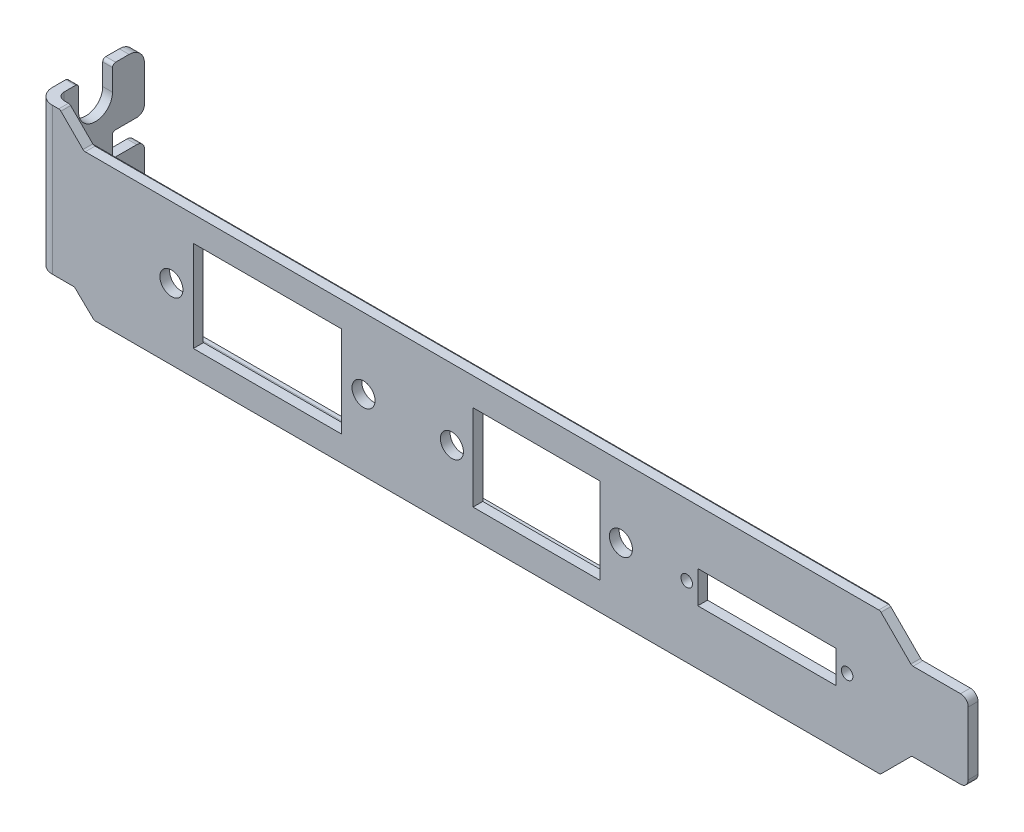
from build123d import *

# Parameters (mm, degrees)
BOSS_EXTRUDE1_DEPTH     = 1.27
SKETCH8_W               = 1.27
SKETCH8_H               = 19.05
BOSS_EXTRUDE3_DEPTH     = 11.454
CUT_EXTRUDE6_REACH      = 125.629
SKETCH9_W               = 4.19
SKETCH9_H               = 3.05
SKETCH10_W              = 100
SKETCH10_H              = 1.5
SKETCH10_W_2            = 105
BOSS_EXTRUDE4_DEPTH     = 1
SKETCH3_R               = 1.5
SKETCH3_W               = 19.3
SKETCH3_H               = 11.85
XT60_CUTOUT_DEPTH       = 124.753307334
CUT_EXTRUDE4_DEPTH      = 124.753307334
CUT_EXTRUDE4_DEPTH_BACK = 124.753307334
SKETCH5_R               = 1.5
SKETCH5_W               = 16.5
SKETCH5_H               = 11.2
SKETCH6_R               = 0.75
SKETCH6_W               = 18
SKETCH6_H               = 4.2
CUT_EXTRUDE5_DEPTH      = 124.753307334
FILLET1_R               = 0.4
FILLET2_R               = 1
FILLET3_R               = 2
FILLET4_R               = 0.5


with BuildPart() as part:
    # Sketch1 → Boss-Extrude1 (new body)
    with BuildSketch(Plane.XY):
        Polygon((0, 2.48), (4.88, 2.48), (7.45, 0), (109.76, 0), (113.85, 4.09), (121.2, 4.09), (121.2, 14.3), (113.85, 14.3), (109.73, 18.42), (6.11, 18.42), (3, 21.53), (0, 21.53), align=None)
    extrude(amount=BOSS_EXTRUDE1_DEPTH)

    # Sketch8 → Boss-Extrude3 (add)
    with BuildSketch(Plane(origin=(0, 0, 0), x_dir=(-1, 0, 0), z_dir=(0, 0, -1))):
        with Locations((-0.635, 12.005)):
            Rectangle(SKETCH8_W, SKETCH8_H)
    extrude(amount=BOSS_EXTRUDE3_DEPTH)

    # Sketch9 → Cut-Extrude6 (cut, up to next)
    with BuildSketch(Plane.ZY, mode=Mode.PRIVATE) as cut_extrude6_sk1:
        with BuildLine():
            Line((-7.29, 18.35), (-7.29, 21.53))
            Line((-7.29, 21.53), (-2.87, 21.53))
            Line((-2.87, 21.53), (-2.87, 18.35))
            ThreePointArc((-2.87, 18.35), (-5.08, 16.14), (-7.29, 18.35))
        make_face()
    cut_extrude6_tool1 = extrude(cut_extrude6_sk1.sketch, amount=-CUT_EXTRUDE6_REACH, mode=Mode.PRIVATE) & part.part
    # Sketch9 → Cut-Extrude6 (cut, up to next)
    with BuildSketch(Plane.ZY, mode=Mode.PRIVATE) as cut_extrude6_sk2:
        with Locations((-9.359, 12.385)):
            Rectangle(SKETCH9_W, SKETCH9_H)
    cut_extrude6_tool2 = extrude(cut_extrude6_sk2.sketch, amount=-CUT_EXTRUDE6_REACH, mode=Mode.PRIVATE) & part.part
    add(cut_extrude6_tool1.solids().sort_by_distance((0, 19.047387, -5.08))[0], mode=Mode.SUBTRACT)
    add(cut_extrude6_tool2.solids().sort_by_distance((0, 12.385, -9.359))[0], mode=Mode.SUBTRACT)

    # Sketch10 → Boss-Extrude4 (add)
    with BuildSketch(Plane(origin=(0, 0, 0), x_dir=(-1, 0, 0), z_dir=(0, 0, -1))):
        with Locations((-57, 2.25)):
            Rectangle(SKETCH10_W, SKETCH10_H)
        with Locations((-56.5, 16.75)):
            Rectangle(SKETCH10_W_2, SKETCH10_H)
    extrude(amount=BOSS_EXTRUDE4_DEPTH)

    # Sketch3 → XT60 cutout (cut, through all)
    with BuildSketch(Plane.XY.offset(1.27)):
        with Locations((17.5, 9.21)):
            Circle(SKETCH3_R)
        with Locations((42.5, 9.21)):
            Circle(SKETCH3_R)
        with Locations((30, 9.21)):
            Rectangle(SKETCH3_W, SKETCH3_H)
    extrude(amount=-XT60_CUTOUT_DEPTH, mode=Mode.SUBTRACT)

    # Sketch5 → Cut-Extrude4 (cut, two sides: drawn at the far end of the back side and taken through both)
    with BuildSketch(Plane.XY.offset(1.27).offset(-CUT_EXTRUDE4_DEPTH_BACK)):
        with Locations((54, 9.21)):
            Circle(SKETCH5_R)
        with Locations((76, 9.21)):
            Circle(SKETCH5_R)
        with Locations((65, 9.21)):
            Rectangle(SKETCH5_W, SKETCH5_H)
    extrude(amount=CUT_EXTRUDE4_DEPTH + CUT_EXTRUDE4_DEPTH_BACK, mode=Mode.SUBTRACT)

    # Sketch6 → Cut-Extrude5 (cut, through all)
    with BuildSketch(Plane.XY.offset(1.27)):
        with Locations((105.44, 9.21)):
            Circle(SKETCH6_R)
        with Locations((84.56, 9.21)):
            Circle(SKETCH6_R)
        with Locations((95, 9.21)):
            Rectangle(SKETCH6_W, SKETCH6_H)
    extrude(amount=-CUT_EXTRUDE5_DEPTH, mode=Mode.SUBTRACT)

    # Fillet1
    fillet1_edges = [part.edges().sort_by_distance(p)[0] for p in [
        (109.76, 0, 0.635),
        (7.45, 0, 0.635),
        (4.88, 2.48, 0.635),
        (3, 21.53, 0.635),
        (6.11, 18.42, 0.635),
        (109.73, 18.42, 0.635),
        (113.85, 14.3, 0.635),
        (113.85, 4.09, 0.635),
        (0.635, 13.91, -7.264),
        (0.635, 10.86, -7.264),
        (0.635, 21.53, -7.29),
        (0.635, 21.53, -2.87),
    ]]
    fillet(fillet1_edges, radius=FILLET1_R)

    # Fillet2
    fillet2_edges = [part.edges().sort_by_distance(p)[0] for p in [
        (121.2, 14.3, 0.635),
        (121.2, 4.09, 0.635),
        (1.27, 12.005, 0),
        (0.635, 10.86, -11.454),
        (0.635, 13.91, -11.454),
    ]]
    fillet(fillet2_edges, radius=FILLET2_R)

    # Fillet3
    fillet3_edges = [part.edges().sort_by_distance(p)[0] for p in [
        (0, 12.005, 1.27),
        (0.635, 21.53, -11.454),
        (0.635, 2.48, -11.454),
    ]]
    fillet(fillet3_edges, radius=FILLET3_R)

    # Fillet4
    # the kernel refuses this fillet: 0.5 mm, written as the material it takes off along each edge
    with BuildSketch(Plane(origin=(109, 17.5, 0), x_dir=(0, -1, 0), z_dir=(0, 0, -1)), Plane(origin=(107, 3, 0), x_dir=(0, -1, 0), z_dir=(0, 0, -1)), Plane(origin=(107, 1.5, 0), x_dir=(-1, 0, 0), z_dir=(0, 0, -1)), Plane(origin=(4, 17.5, 0), x_dir=(1, 0, 0), z_dir=(0, 0, -1))) as fillet4_piece_1:
        with BuildLine():
            CenterArc((FILLET4_R, FILLET4_R), FILLET4_R, 180, 90)
            Line((0, FILLET4_R), (0, 0))
            Line((0, 0), (FILLET4_R, 0))
        make_face()
    extrude(amount=2.25, mode=Mode.SUBTRACT)
    with BuildSketch(Plane(origin=(109, 18.75, -1), x_dir=(0, 0, 1), z_dir=(0, -1, 0)), Plane(origin=(4, 14.75, -1), x_dir=(0, 0, 1), z_dir=(0, 1, 0))) as fillet4_piece_2:
        with BuildLine():
            CenterArc((FILLET4_R, FILLET4_R), FILLET4_R, 180, 90)
            Line((0, FILLET4_R), (0, 0))
            Line((0, 0), (FILLET4_R, 0))
        make_face()
    extrude(amount=4, mode=Mode.SUBTRACT)
    with BuildSketch(Plane(origin=(109, 16, 0), x_dir=(0, 1, 0), z_dir=(0, 0, -1)), Plane(origin=(4, 16, 0), x_dir=(1, 0, 0), z_dir=(0, 0, -1)), Plane(origin=(7, 1.5, 0), x_dir=(1, 0, 0), z_dir=(0, 0, -1)), Plane(origin=(7, 3, 0), x_dir=(0, -1, 0), z_dir=(0, 0, -1))) as fillet4_piece_3:
        with BuildLine():
            CenterArc((FILLET4_R, -FILLET4_R), FILLET4_R, 90, 90)
            Line((0, -FILLET4_R), (0, 0))
            Line((0, 0), (FILLET4_R, 0))
        make_face()
    extrude(amount=2.25, mode=Mode.SUBTRACT)
    with BuildSketch(Plane(origin=(107, 0.25, -1), x_dir=(0, 0, 1), z_dir=(0, 1, 0)), Plane(origin=(7, 4.25, -1), x_dir=(0, 0, 1), z_dir=(0, -1, 0))) as fillet4_piece_4:
        with BuildLine():
            CenterArc((FILLET4_R, -FILLET4_R), FILLET4_R, 90, 90)
            Line((0, -FILLET4_R), (0, 0))
            Line((0, 0), (FILLET4_R, 0))
        make_face()
    extrude(amount=4, mode=Mode.SUBTRACT)
    # the kernel refuses this fillet: 0.5 mm, written as the material it adds along each edge
    with BuildSketch(Plane(origin=(108.5, 16, 0), x_dir=(0, -1, 0), z_dir=(-1, 0, 0)), Plane(origin=(4.5, 17.5, 0), x_dir=(0, 1, 0), z_dir=(1, 0, 0))) as fillet4_2_piece_1:
        with BuildLine():
            CenterArc((FILLET4_R, -FILLET4_R), FILLET4_R, 90, 90)
            Line((0, -FILLET4_R), (0, 0))
            Line((0, 0), (FILLET4_R, 0))
        make_face()
    extrude(amount=104)
    with BuildSketch(Plane(origin=(7.5, 1.5, 0), x_dir=(0, -1, 0), z_dir=(1, 0, 0))) as fillet4_2_piece_2:
        with BuildLine():
            CenterArc((FILLET4_R, FILLET4_R), FILLET4_R, 180, 90)
            Line((0, FILLET4_R), (0, 0))
            Line((0, 0), (FILLET4_R, 0))
        make_face()
    extrude(amount=99)
    with BuildSketch(Plane(origin=(106.5, 3, 0), x_dir=(0, 1, 0), z_dir=(-1, 0, 0))) as fillet4_2_piece_3_section:
        with BuildLine():
            CenterArc((FILLET4_R, FILLET4_R), FILLET4_R, 180, 90)
            Line((0, FILLET4_R), (0, 0))
            Line((0, 0), (FILLET4_R, 0))
        make_face()
    fillet4_2_piece_3 = extrude(amount=99, mode=Mode.PRIVATE)
    fillet4_2_piece_3 = split(fillet4_2_piece_3, bisect_by=Plane(origin=(73.075, 3.285, -0.00692804), z_dir=(0, 1, 0)), keep=Keep.TOP, mode=Mode.PRIVATE)
    fillet4_2_piece_3 = split(fillet4_2_piece_3, bisect_by=Plane(origin=(39.65, 3.359200662, -0.00692804), z_dir=(1, 0, 0)), keep=Keep.TOP, mode=Mode.PRIVATE)
    add(fillet4_2_piece_3)
    with BuildSketch(Plane(origin=(106.5, 3, 0), x_dir=(0, 1, 0), z_dir=(-1, 0, 0))) as fillet4_2_piece_4_section:
        with BuildLine():
            CenterArc((FILLET4_R, FILLET4_R), FILLET4_R, 180, 90)
            Line((0, FILLET4_R), (0, 0))
            Line((0, 0), (FILLET4_R, 0))
        make_face()
    fillet4_2_piece_4 = extrude(amount=99, mode=Mode.PRIVATE)
    fillet4_2_piece_4 = split(fillet4_2_piece_4, bisect_by=Plane(origin=(73.075, 3.285, -0.123354131), z_dir=(0, -1, 0)), keep=Keep.TOP, mode=Mode.PRIVATE)
    fillet4_2_piece_4 = split(fillet4_2_piece_4, bisect_by=Plane(origin=(39.65, 3.089686123, -0.123354131), z_dir=(1, 0, 0)), keep=Keep.TOP, mode=Mode.PRIVATE)
    add(fillet4_2_piece_4)
    with BuildSketch(Plane(origin=(106.5, 3, 0), x_dir=(0, 1, 0), z_dir=(-1, 0, 0))) as fillet4_2_piece_5_section:
        with BuildLine():
            CenterArc((FILLET4_R, FILLET4_R), FILLET4_R, 180, 90)
            Line((0, FILLET4_R), (0, 0))
            Line((0, 0), (FILLET4_R, 0))
        make_face()
    fillet4_2_piece_5 = extrude(amount=99, mode=Mode.PRIVATE)
    fillet4_2_piece_5 = split(fillet4_2_piece_5, bisect_by=Plane(origin=(30, 3.285, -0.123354131), z_dir=(0, -1, 0)), keep=Keep.TOP, mode=Mode.PRIVATE)
    fillet4_2_piece_5 = split(fillet4_2_piece_5, bisect_by=Plane(origin=(20.35, 3.089686123, -0.123354131), z_dir=(1, 0, 0)), keep=Keep.TOP, mode=Mode.PRIVATE)
    fillet4_2_piece_5 = split(fillet4_2_piece_5, bisect_by=Plane(origin=(39.65, 3.089686123, -0.123354131), z_dir=(-1, 0, 0)), keep=Keep.TOP, mode=Mode.PRIVATE)
    add(fillet4_2_piece_5)
    with BuildSketch(Plane(origin=(106.5, 3, 0), x_dir=(0, 1, 0), z_dir=(-1, 0, 0))) as fillet4_2_piece_6_section:
        with BuildLine():
            CenterArc((FILLET4_R, FILLET4_R), FILLET4_R, 180, 90)
            Line((0, FILLET4_R), (0, 0))
            Line((0, 0), (FILLET4_R, 0))
        make_face()
    fillet4_2_piece_6 = extrude(amount=99, mode=Mode.PRIVATE)
    fillet4_2_piece_6 = split(fillet4_2_piece_6, bisect_by=Plane(origin=(13.925, 3.285, -0.00692804), z_dir=(0, 1, 0)), keep=Keep.TOP, mode=Mode.PRIVATE)
    fillet4_2_piece_6 = split(fillet4_2_piece_6, bisect_by=Plane(origin=(20.35, 3.359200662, -0.00692804), z_dir=(-1, 0, 0)), keep=Keep.TOP, mode=Mode.PRIVATE)
    add(fillet4_2_piece_6)
    with BuildSketch(Plane(origin=(106.5, 3, 0), x_dir=(0, 1, 0), z_dir=(-1, 0, 0))) as fillet4_2_piece_7_section:
        with BuildLine():
            CenterArc((FILLET4_R, FILLET4_R), FILLET4_R, 180, 90)
            Line((0, FILLET4_R), (0, 0))
            Line((0, 0), (FILLET4_R, 0))
        make_face()
    fillet4_2_piece_7 = extrude(amount=99, mode=Mode.PRIVATE)
    fillet4_2_piece_7 = split(fillet4_2_piece_7, bisect_by=Plane(origin=(13.925, 3.285, -0.123354131), z_dir=(0, -1, 0)), keep=Keep.TOP, mode=Mode.PRIVATE)
    fillet4_2_piece_7 = split(fillet4_2_piece_7, bisect_by=Plane(origin=(20.35, 3.089686123, -0.123354131), z_dir=(-1, 0, 0)), keep=Keep.TOP, mode=Mode.PRIVATE)
    add(fillet4_2_piece_7)
    with BuildSketch(Plane(origin=(109, 17, 0), x_dir=(1, 0, 0), z_dir=(0, -1, 0)), Plane(origin=(4, 16.5, 0), x_dir=(-1, 0, 0), z_dir=(0, 1, 0))) as fillet4_2_piece_8:
        with BuildLine():
            CenterArc((FILLET4_R, -FILLET4_R), FILLET4_R, 90, 90)
            Line((0, -FILLET4_R), (0, 0))
            Line((0, 0), (FILLET4_R, 0))
        make_face()
    extrude(amount=0.5)
    with BuildSketch(Plane(origin=(107, 2, 0), x_dir=(1, 0, 0), z_dir=(0, 1, 0)), Plane(origin=(7, 2.5, 0), x_dir=(-1, 0, 0), z_dir=(0, -1, 0))) as fillet4_2_piece_9:
        with BuildLine():
            CenterArc((FILLET4_R, FILLET4_R), FILLET4_R, 180, 90)
            Line((0, FILLET4_R), (0, 0))
            Line((0, 0), (FILLET4_R, 0))
        make_face()
    extrude(amount=0.5)
    with BuildSketch(Plane(origin=(7.5, 2.5, 0), x_dir=(-1, 0, 0), z_dir=(0, -1, 0))) as fillet4_2_piece_10:
        with BuildLine():
            CenterArc((0.5 + FILLET4_R, FILLET4_R), FILLET4_R, 180, 90)
            Line((0.5, FILLET4_R), (0.5, 0))
            Line((0.5, 0), (0.5 + FILLET4_R, 0))
        make_face()
    revolve(axis=Axis((7.5, 2.5, 0), (0, 0, -1)), revolution_arc=90)
    with BuildSketch(Plane(origin=(7.5, 2, 0), x_dir=(0, -1, 0), z_dir=(1, 0, 0))) as fillet4_2_piece_11:
        with BuildLine():
            CenterArc((0.5 + FILLET4_R, FILLET4_R), FILLET4_R, 180, 90)
            Line((0.5, FILLET4_R), (0.5, 0))
            Line((0.5, 0), (0.5 + FILLET4_R, 0))
        make_face()
    revolve(axis=Axis((7.5, 2, 0), (0, 0, -1)), revolution_arc=90)
    with BuildSketch(Plane(origin=(4.5, 16.5, 0), x_dir=(0, -1, 0), z_dir=(1, 0, 0))) as fillet4_2_piece_12:
        with BuildLine():
            CenterArc((0.5 + FILLET4_R, FILLET4_R), FILLET4_R, 180, 90)
            Line((0.5, FILLET4_R), (0.5, 0))
            Line((0.5, 0), (0.5 + FILLET4_R, 0))
        make_face()
    revolve(axis=Axis((4.5, 16.5, 0), (0, 0, -1)), revolution_arc=90)
    with BuildSketch(Plane(origin=(4.5, 17, 0), x_dir=(0, 1, 0), z_dir=(1, 0, 0))) as fillet4_2_piece_13:
        with BuildLine():
            CenterArc((0.5 + FILLET4_R, -FILLET4_R), FILLET4_R, 90, 90)
            Line((0.5, -FILLET4_R), (0.5, 0))
            Line((0.5, 0), (0.5 + FILLET4_R, 0))
        make_face()
    revolve(axis=Axis((4.5, 17, 0), (0, 0, 1)), revolution_arc=90)
    with BuildSketch(Plane(origin=(106.5, 2, 0), x_dir=(0, -1, 0), z_dir=(-1, 0, 0))) as fillet4_2_piece_14:
        with BuildLine():
            CenterArc((0.5 + FILLET4_R, -FILLET4_R), FILLET4_R, 90, 90)
            Line((0.5, -FILLET4_R), (0.5, 0))
            Line((0.5, 0), (0.5 + FILLET4_R, 0))
        make_face()
    revolve(axis=Axis((106.5, 2, 0), (0, 0, 1)), revolution_arc=90)
    with BuildSketch(Plane(origin=(106.5, 2.5, 0), x_dir=(1, 0, 0), z_dir=(0, -1, 0))) as fillet4_2_piece_15:
        with BuildLine():
            CenterArc((0.5 + FILLET4_R, -FILLET4_R), FILLET4_R, 90, 90)
            Line((0.5, -FILLET4_R), (0.5, 0))
            Line((0.5, 0), (0.5 + FILLET4_R, 0))
        make_face()
    revolve(axis=Axis((106.5, 2.5, 0), (0, 0, 1)), revolution_arc=90)
    with BuildSketch(Plane(origin=(108.5, 17, 0), x_dir=(1, 0, 0), z_dir=(0, -1, 0))) as fillet4_2_piece_16:
        with BuildLine():
            CenterArc((0.5 + FILLET4_R, -FILLET4_R), FILLET4_R, 90, 90)
            Line((0.5, -FILLET4_R), (0.5, 0))
            Line((0.5, 0), (0.5 + FILLET4_R, 0))
        make_face()
    revolve(axis=Axis((108.5, 17, 0), (0, 0, 1)), revolution_arc=90)
    with BuildSketch(Plane(origin=(108.5, 16.5, 0), x_dir=(1, 0, 0), z_dir=(0, 1, 0))) as fillet4_2_piece_17:
        with BuildLine():
            CenterArc((0.5 + FILLET4_R, FILLET4_R), FILLET4_R, 180, 90)
            Line((0.5, FILLET4_R), (0.5, 0))
            Line((0.5, 0), (0.5 + FILLET4_R, 0))
        make_face()
    revolve(axis=Axis((108.5, 16.5, 0), (0, 0, -1)), revolution_arc=90)


solid = part.part
